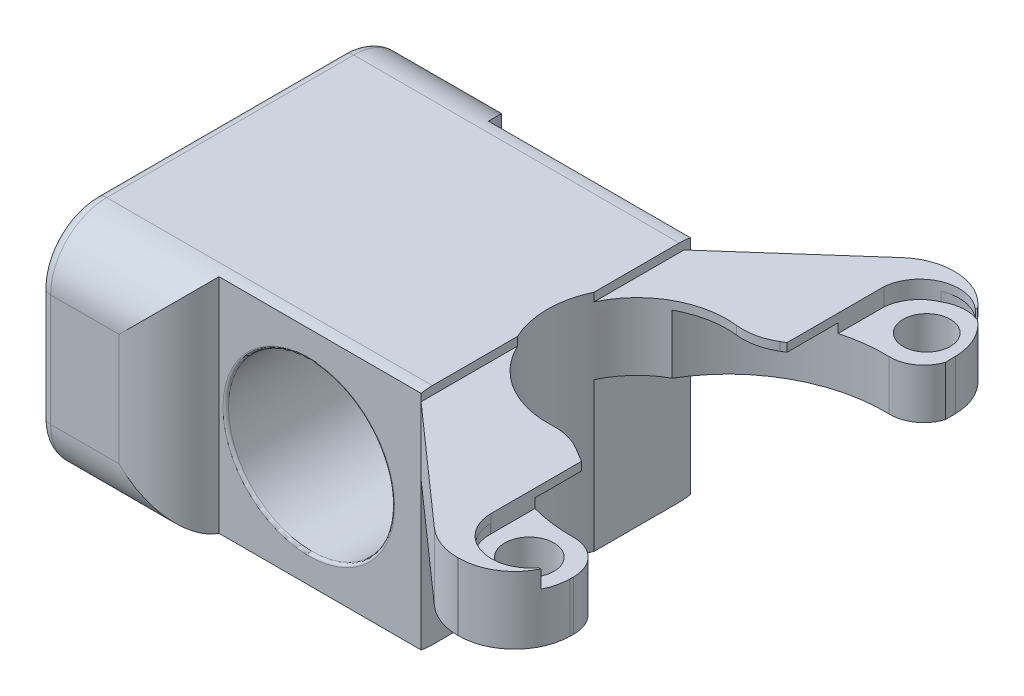
from build123d import *

# Parameters (mm, degrees)
ESQUISSE1_W                  = 20
ESQUISSE1_H                  = 20
BOSS_EXTRU_1_DEPTH           = 24
BOSS_EXTRU_2_DEPTH           = 10
BOSS_EXTRU_2_DEPTH_BACK      = 2
ESQUISSE2_W                  = 32
ESQUISSE2_H                  = 20
CONG_1_R                     = 5
ENL_V_MAT_EXTRU_1_DEPTH      = 36.832945734
ENL_V_MAT_EXTRU_1_DEPTH_BACK = 36.832945734
ESQUISSE3_R                  = 7.4
CONG_4_START                 = -21
CONG_4_DEPTH                 = 31
CONG_5_R                     = 1
EMPREINTE1_START             = -20
EMPREINTE1_OUTLINE_R         = 4
EMPREINTE1_DEPTH             = 8.813354444
CONG_7_R                     = 0.25
BOSS_EXTRU_3_DEPTH           = 6
ENL_V_MAT_EXTRU_2_DEPTH      = 6
ENL_V_MAT_EXTRU_2_DEPTH_BACK = 49.80115679
ESQUISSE5_R                  = 8
CONG_9_R                     = 5
EMPREINTE2_START             = 3.25
EMPREINTE2_DEPTH             = 5.25
EMPREINTE2_START_2           = 7.68
EMPREINTE2_2_OUTLINE_R       = 2.1
EMPREINTE2_2_DEPTH           = 0.82
ENL_V_MAT_EXTRU_10_DEPTH     = 10
ESQUISSE8_W                  = 1.517338975
ESQUISSE8_H                  = 36.644648297
ENL_V_MAT_EXTRU_11_DEPTH     = 10
ESQUISSE10_W                 = 1.446938529
ESQUISSE10_H                 = 39.479096678
ENL_V_MAT_EXTRU_12_DEPTH     = 10
ESQUISSE11_R                 = 2.193445126
ESQUISSE11_R_2               = 2.1
ENL_V_MAT_EXTRU_13_DEPTH     = 10
CONG_13_R                    = 3
ESQUISSE12_R                 = 4.15
ENL_V_MAT_EXTRU_14_DEPTH     = 8.813354444
CONG_15_R                    = 0.25


with BuildPart() as part:
    # Esquisse1 → Boss.-Extru.1 (new body)
    with BuildSketch(Plane.XY):
        Rectangle(ESQUISSE1_W, ESQUISSE1_H)
    extrude(amount=BOSS_EXTRU_1_DEPTH)

    # Esquisse2 → Boss.-Extru.2 (add, two sides: drawn at the far end of the back side and taken through both)
    with BuildSketch(Plane.ZY.offset(10).offset(-BOSS_EXTRU_2_DEPTH_BACK)):
        with Locations((12, 0)):
            Rectangle(ESQUISSE2_W, ESQUISSE2_H)
    extrude(amount=BOSS_EXTRU_2_DEPTH + BOSS_EXTRU_2_DEPTH_BACK)

    # Congé1
    # the kernel refuses this fillet: 5 mm, written as the material it takes off along each edge
    with BuildSketch(Plane(origin=(-8, 22.247448714, -4), x_dir=(-1, 0, 0), z_dir=(0, -1, 0))) as cong_1_piece_1:
        with BuildLine():
            CenterArc((4.898979486, -5), CONG_1_R, 90, 78.463040967)
            Line((0, -4), (-0.09797959, -3.98))
            ThreePointArc((-0.09797959, -3.98), (-0.1, -2), (-0.1, 0))
            Line((-0.1, 0), (0, 0.1))
            Line((0, 0.1), (4.898979486, 0.1))
            Line((4.898979486, 0.1), (4.898979486, 0))
        make_face()
    extrude(amount=44.494897428, mode=Mode.SUBTRACT)
    with BuildSketch(Plane(origin=(-8, -22.247448714, 28), x_dir=(-1.5565326805242233e-12, 0, -1.0), z_dir=(0, 1, 0))) as cong_1_piece_2:
        with BuildLine():
            CenterArc((5, 4.898979486), CONG_1_R, 180, 78.463040967)
            Line((0, 4.898979486), (-0.1, 4.898979486))
            Line((-0.1, 4.898979486), (-0.1, 0))
            Line((-0.1, 0), (0, -0.1))
            ThreePointArc((0, -0.1), (2, -0.1), (3.98, -0.09797959))
            Line((3.98, -0.09797959), (4, 0))
        make_face()
    extrude(amount=44.494897428, mode=Mode.SUBTRACT)

    # Esquisse3 → Enlèv. mat.-Extru.1 (cut, two sides: drawn at the far end of the back side and taken through both)
    with BuildSketch(Plane.XY.offset(24).offset(-ENL_V_MAT_EXTRU_1_DEPTH_BACK)):
        with Locations(Location((0, 0, 0), (0, 0, 180))):
            Circle(ESQUISSE3_R)
    extrude(amount=ENL_V_MAT_EXTRU_1_DEPTH + ENL_V_MAT_EXTRU_1_DEPTH_BACK, mode=Mode.SUBTRACT)

    # Congé4: read off the stored shape, not the designer's step
    # Congé4 outline → Congé4 (cut)
    with BuildSketch(Plane.YZ.offset(CONG_4_START)):
        with BuildLine():
            ThreePointArc((-5, -4), (-8.535533906, -2.535533906), (-10, 1))
            Line((-10, 1), (-10, -4))
            Line((-10, -4), (-5, -4))
        make_face()
        with BuildLine():
            Line((-10, 28), (-10, 23))
            ThreePointArc((-10, 23), (-8.535533906, 26.535533906), (-5, 28))
            Line((-5, 28), (-10, 28))
        make_face()
        with BuildLine():
            ThreePointArc((10, 1), (8.535533906, -2.535533906), (5, -4))
            Line((5, -4), (10, -4))
            Line((10, -4), (10, 1))
        make_face()
        with BuildLine():
            Line((10, 28), (5, 28))
            ThreePointArc((5, 28), (8.535533906, 26.535533906), (10, 23))
            Line((10, 23), (10, 28))
        make_face()
    extrude(amount=CONG_4_DEPTH, mode=Mode.SUBTRACT)

    # Congé5
    cong_5_edges = [part.edges().sort_by_distance(p)[0] for p in [
        (-20, 0, -4),
        (-20, 0, 28),
        (-20, 10, 12),
        (-20, -10, 12),
        (-20, 8.535533906, 26.535533906),
        (-20, -8.535533906, 26.535533906),
        (-20, 8.535533906, -2.535533906),
        (-20, -8.535533906, -2.535533906),
    ]]
    fillet(cong_5_edges, radius=CONG_5_R)

    # Empreinte1: read off the stored shape, not the designer's step
    # Empreinte1 outline → Empreinte1 (cut)
    with BuildSketch(Plane.YZ.offset(EMPREINTE1_START)):
        with Locations((0, 2.285680752)):
            Circle(EMPREINTE1_OUTLINE_R)
        with Locations((0, 21.714319248)):
            Circle(EMPREINTE1_OUTLINE_R)
    extrude(amount=EMPREINTE1_DEPTH, mode=Mode.SUBTRACT)

    # Congé7
    cong_7_edges = [part.edges().sort_by_distance(p)[0] for p in [
        (7.4, 0, 24),
        (7.4, 0, 0),
    ]]
    fillet(cong_7_edges, radius=CONG_7_R)

    # Esquisse4 → Boss.-Extru.3 (add)
    with BuildSketch(Plane(origin=(0, 9.25, 0), x_dir=(1, 0, 0), z_dir=(0, 1, 0))):
        Polygon((10, -24), (21.735008047, -34.390334815), (28.651906702, -34.390334815), (28.780119379, -25.689379844), (10, -14.387125776), align=None)
        Polygon((21.735008047, 9.812794761), (28.651906702, 9.812794761), (28.780119379, 1.11183979), (10, -10.190414278), (10, -0.577540054), align=None)
    extrude(amount=-BOSS_EXTRU_3_DEPTH)

    # Esquisse5 → Enlèv. mat.-Extru.2 (cut, two sides: drawn at the far end of the back side and taken through both)
    with BuildSketch(Plane(origin=(0, 9.25, 0), x_dir=(1, 0, 0), z_dir=(0, 1, 0)).offset(-ENL_V_MAT_EXTRU_2_DEPTH_BACK)):
        with Locations((17.235008047, -12)):
            Circle(ESQUISSE5_R)
    extrude(amount=ENL_V_MAT_EXTRU_2_DEPTH + ENL_V_MAT_EXTRU_2_DEPTH_BACK, mode=Mode.SUBTRACT)

    # Congé9
    cong_9_edges = [part.edges().sort_by_distance(p)[0] for p in [
        (28.780119379, 6.25, 25.689379844),
        (28.651906702, 6.25, 34.390334815),
        (21.735008047, 6.25, 34.390334815),
        (21.735008047, 6.25, -9.812794761),
        (28.651906702, 6.25, -9.812794761),
        (28.780119379, 6.25, -1.11183979),
        (19.660479071, 6.25, 4.376543414),
        (18.999232398, 6.25, 19.803045075),
    ]]
    fillet(cong_9_edges, radius=CONG_9_R)

    # Empreinte2: read off the stored shape, not the designer's step
    # Empreinte2 outline → Empreinte2 (cut)
    with BuildSketch(Plane(origin=(0, 0, 0), x_dir=(1, 0, 0), z_dir=(0, 1, 0)).offset(EMPREINTE2_START)):
        with BuildLine():
            ThreePointArc((17.649730777, -19.989243084), (15.35076315, -19.774935445), (13.208752532, -18.912978123))
            ThreePointArc((13.208752532, -18.912978123), (19.481469237, -24.765100097), (27.990063865, -25.859688559))
            ThreePointArc((27.990063865, -25.859688559), (27.251872882, -24.933392554), (26.316507021, -24.20672831))
            Line((26.316507021, -24.20672831), (20.487142429, -20.698499297))
            ThreePointArc((20.487142429, -20.698499297), (19.121455018, -20.131768616), (17.649730777, -19.989243084))
        make_face()
        with BuildLine():
            ThreePointArc((28.187748673, 1.632336222), (19.719755676, 0.685172024), (13.369286614, -4.995987022))
            ThreePointArc((13.369286614, -4.995987022), (15.694722516, -4.14968023), (18.167541779, -4.054537091))
            ThreePointArc((18.167541779, -4.054537091), (19.804712323, -3.976196156), (21.328585306, -3.372643487))
            Line((21.328585306, -3.372643487), (26.316507021, -0.370811744))
            ThreePointArc((26.316507021, -0.370811744), (27.39208376, 0.500022355), (28.187748673, 1.632336222))
        make_face()
    extrude(amount=EMPREINTE2_DEPTH, mode=Mode.SUBTRACT)

    # Empreinte2 2 outline → Empreinte2 2 (cut)
    # profile 1 of 2: a face of its own
    with BuildSketch(Plane(origin=(0, 0, 0), x_dir=(1, 0, 0), z_dir=(0, 1, 0)).offset(EMPREINTE2_START_2)):
        with BuildLine():
            ThreePointArc((26.915705435, 8.662426184), (23.682222766, 8.307266393), (22.137563205, 5.444474838))
            Line((22.137563205, 5.444474838), (22.092220629, 1.500177164))
            ThreePointArc((22.092220629, 1.500177164), (25.132702926, 1.902109264), (28.187748673, 1.632336222))
            ThreePointArc((28.187748673, 1.632336222), (28.607222702, 2.775859748), (28.73775433, 3.986878332))
            Line((28.73775433, 3.986878332), (28.724498509, 4.886464122))
            ThreePointArc((28.724498509, 4.886464122), (28.234364336, 6.972888592), (26.915705435, 8.662426184))
        make_face()
        with Locations((25.637331962, 5.404242447)):
            Circle(EMPREINTE2_2_OUTLINE_R, mode=Mode.SUBTRACT)
    # profile 2 of 2: a face of its own
    with BuildSketch(Plane(origin=(0, 0, 0), x_dir=(1, 0, 0), z_dir=(0, 1, 0)).offset(EMPREINTE2_START_2)):
        with BuildLine():
            ThreePointArc((27.990063865, -25.859688559), (24.871232479, -26.083198324), (21.780581865, -25.608915061))
            Line((21.780581865, -25.608915061), (21.735239289, -29.553212735))
            ThreePointArc((21.735239289, -29.553212735), (24.615179041, -33.038123922), (28.529279907, -30.77571959))
            ThreePointArc((28.529279907, -30.77571959), (28.670570821, -30.126362885), (28.724498509, -29.464004177))
            Line((28.724498509, -29.464004177), (28.73775433, -28.564418387))
            ThreePointArc((28.73775433, -28.564418387), (28.557547789, -27.158524354), (27.990063865, -25.859688559))
        make_face()
        with Locations((25.235008047, -29.593445126)):
            Circle(EMPREINTE2_2_OUTLINE_R, mode=Mode.SUBTRACT)
    extrude(amount=EMPREINTE2_2_DEPTH, mode=Mode.SUBTRACT)

    # Esquisse7 → Enlèv. mat.-Extru.10 (cut)
    with BuildSketch(Plane(origin=(0, 7.68, 0), x_dir=(1, 0, 0), z_dir=(0, 1, 0))):
        with BuildLine():
            Line((21.735008047, -25.555441712), (21.735008047, -29.5))
            ThreePointArc((21.735008047, -29.5), (25.247751189, -32.976747319), (28.724498509, -29.464004177))
            Line((28.724498509, -29.464004177), (28.724498509, 4.886464122))
            ThreePointArc((28.724498509, 4.886464122), (25.536521216, 8.687977292), (21.735008047, 5.5))
            Line((21.735008047, 5.5), (21.735008047, 1.555441712))
            Line((21.735008047, 1.555441712), (21.735008047, -25.555441712))
        make_face()
    extrude(amount=ENL_V_MAT_EXTRU_10_DEPTH, mode=Mode.SUBTRACT)


with BuildPart() as enl_v_mat_extru_10_piece_1:
    # of the separate pieces the step leaves, piece 1, a body of its own (enl_v_mat_extru_10_pieces)
    add(part.part.solids().sort_by_distance((17.649730777, 9.25, 19.989243084))[0])


with BuildPart() as enl_v_mat_extru_10_piece_2:
    # of the separate pieces the step leaves, piece 2, a body of its own (enl_v_mat_extru_10_pieces)
    add(part.part.solids().sort_by_distance((28.724498509, 9.25, 28.119541158))[0])


with BuildPart() as enl_v_mat_extru_10_piece_3:
    # of the separate pieces the step leaves, piece 3, a body of its own (enl_v_mat_extru_10_pieces)
    add(part.part.solids().sort_by_distance((28.724498509, 9.25, -3.542001104))[0])


with BuildPart() as enl_v_mat_extru_11_tool:
    # Esquisse8 → Enlèv. mat.-Extru.11 (new body)
    with BuildSketch(Plane(origin=(0, 7.68, 0), x_dir=(1, 0, 0), z_dir=(0, 1, 0))):
        with Locations((28.329525031, -12.119956541)):
            Rectangle(ESQUISSE8_W, ESQUISSE8_H)
    extrude(amount=ENL_V_MAT_EXTRU_11_DEPTH)


with BuildPart() as enl_v_mat_extru_10_piece_1_1:
    add(enl_v_mat_extru_10_piece_1.part)

    # Enlèv. mat.-Extru.11: cut by enl_v_mat_extru_11_tool
    add(enl_v_mat_extru_11_tool.part, mode=Mode.SUBTRACT)

    # Esquisse10 → Enlèv. mat.-Extru.12 (cut)
    with BuildSketch(Plane(origin=(0, 7.68, 0), x_dir=(1, 0, 0), z_dir=(0, 1, 0))):
        with Locations((28.210080316, -11.825088843)):
            Rectangle(ESQUISSE10_W, ESQUISSE10_H)
    extrude(amount=ENL_V_MAT_EXTRU_12_DEPTH, mode=Mode.SUBTRACT)

    # Esquisse11 → Enlèv. mat.-Extru.13 (cut)
    with BuildSketch(Plane(origin=(0, 7.68, 0), x_dir=(1, 0, 0), z_dir=(0, 1, 0))):
        with Locations(Location((25.235008047, -29.593445126, 0), (0, 0, 180))):
            Circle(ESQUISSE11_R)
        with Locations(Location((25.637331962, 5.404242447, 0), (0, 0, 180))):
            Circle(ESQUISSE11_R_2)
    extrude(amount=-ENL_V_MAT_EXTRU_13_DEPTH, mode=Mode.SUBTRACT)

    # Congé13
    # the kernel refuses this fillet: 3 mm, written as the material it takes off along each edge
    with BuildSketch(Plane(origin=(28.187748673, -2.794819462, -1.632336222), x_dir=(-0.9937380148101644, 0, -0.11173521343405236), z_dir=(0, 1, 0))) as cong_13_piece_1:
        with BuildLine():
            CenterArc((2.658396201, -2.988948838), CONG_13_R, 94.919425392, 73.783351826)
            ThreePointArc((-0.283476264, -2.401253002), (-0.289075444, -1.183232819), (0, 0))
            ThreePointArc((0, 0), (1.200566026, -0.051572088), (2.401132053, 0))
        make_face()
    extrude(amount=16.519638924, mode=Mode.SUBTRACT)
    with BuildSketch(Plane(origin=(27.990063865, -5.147355834, 25.859688559), x_dir=(-0.9949685219943973, 0, 0.10018802443548065), z_dir=(0, 1, 0))) as cong_13_piece_2:
        with BuildLine():
            CenterArc((2.572882872, 2.989649586), CONG_13_R, 173.405782892, 91.833407481)
            Line((-0.407270212, 3.33416025), (-0.70528552, 3.368611317))
            ThreePointArc((-0.70528552, 3.368611317), (-0.770962247, 2.800481736), (-0.269638492, -0.131510774))
            Line((-0.269638492, -0.131510774), (0.024898866, -0.298964959))
            ThreePointArc((0.024898866, -0.298964959), (1.161947103, -0.251698066), (2.29899534, -0.298964959))
            Line((2.29899534, -0.298964959), (2.323894207, 0))
        make_face()
    extrude(amount=21.224711669, mode=Mode.SUBTRACT)

    # Esquisse12 → Enlèv. mat.-Extru.14 (cut)
    with BuildSketch(Plane.ZY.offset(20)):
        with Locations((2.285680752, 0)):
            Circle(ESQUISSE12_R)
        with Locations((21.714319248, 0)):
            Circle(ESQUISSE12_R)
    extrude(amount=-ENL_V_MAT_EXTRU_14_DEPTH, mode=Mode.SUBTRACT)

    # Congé15
    cong_15_edges = [enl_v_mat_extru_10_piece_1_1.edges().sort_by_distance(p)[0] for p in [
        (-20, 0, -1.864319248),
        (-20, 0, 17.564319248),
    ]]
    fillet(cong_15_edges, radius=CONG_15_R)


with BuildPart() as enl_v_mat_extru_10_piece_2_1:
    add(enl_v_mat_extru_10_piece_2.part)

    # Enlèv. mat.-Extru.11: cut by enl_v_mat_extru_11_tool
    add(enl_v_mat_extru_11_tool.part, mode=Mode.SUBTRACT)


with BuildPart() as enl_v_mat_extru_10_piece_3_1:
    add(enl_v_mat_extru_10_piece_3.part)

    # Enlèv. mat.-Extru.11: cut by enl_v_mat_extru_11_tool
    add(enl_v_mat_extru_11_tool.part, mode=Mode.SUBTRACT)


solid = enl_v_mat_extru_10_piece_1_1.part
